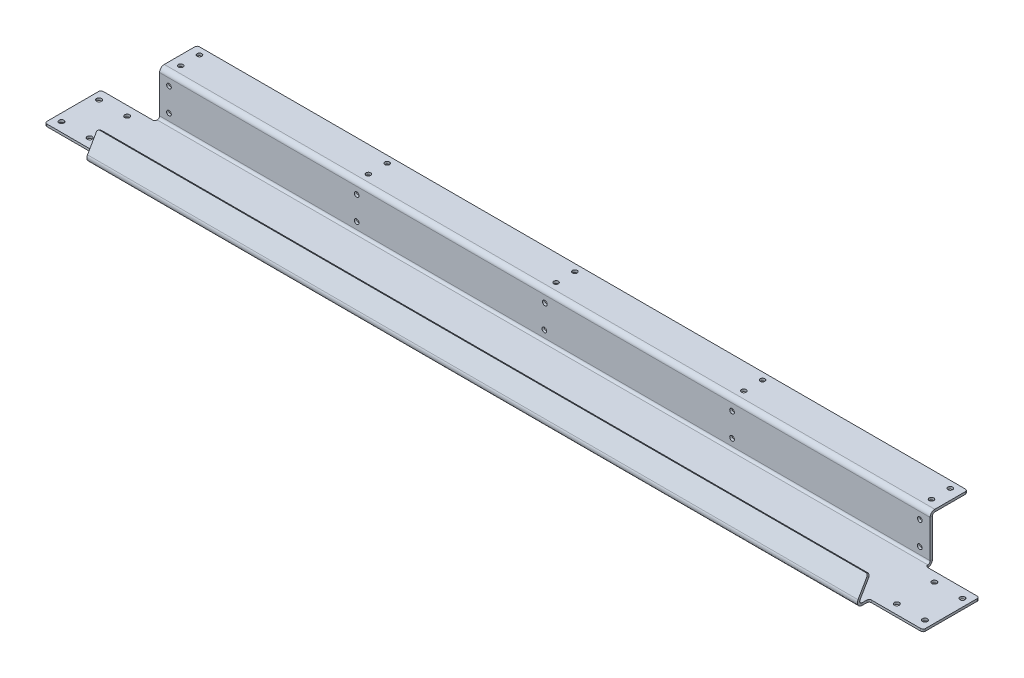
from build123d import *

# Parameters (mm, degrees)
BASE_FLANGE1_DEPTH               = 3.175
EDGE_FLANGE1_START               = -521.335
EDGE_FLANGE1_DEPTH               = 1042.67
EDGE_FLANGE1_START_2             = -521.760369343
EDGE_FLANGE1_2_DEPTH             = 0.425369343
EDGE_FLANGE1_START_3             = 521.335
EDGE_FLANGE1_3_DEPTH             = 0.425369343
EDGE_FLANGE1_4_DEPTH             = 1042.67
EDGE_FLANGE2_DEPTH               = 1042.67
EDGE_FLANGE3_STRIP_W             = 19.05
EDGE_FLANGE3_STRIP_H             = 3.175
EDGE_FLANGE3_STRIP_CUT_DEPTH     = 1042.67
EDGE_FLANGE3_DEPTH               = 1042.67
FILLET1_R                        = 3.175
F_17_64_0_26563_DIAMETER_HOLE1_D = 6.747002
F_1_4_0_25_DIAMETER_HOLE1_D      = 6.35
F_1_4_0_25_DIAMETER_HOLE2_D      = 6.35
F_1_4_0_25_DIAMETER_HOLE2_DEPTH  = 3.175


# Read off the part's stored shape, not the designer's step: Edge-Flange1
# Sheet-metal steps are written as plain solids
with BuildPart() as part:
    # Sketch1 → Base-Flange1 (new body)
    with BuildSketch(Plane(origin=(0, 0, 0), x_dir=(1, 0, 0), z_dir=(0, 1, 0))):
        with BuildLine():
            Line((-521.335, 41.275), (-521.335, 47.625))
            Line((-521.335, 47.625), (521.335, 47.625))
            Line((521.335, 47.625), (521.335, 41.275))
            ThreePointArc((521.335, 41.275), (522.26493597, 39.02993597), (524.51, 38.1))
            Line((524.51, 38.1), (594.36, 38.1))
            Line((594.36, 38.1), (594.36, -38.1))
            Line((594.36, -38.1), (524.51, -38.1))
            ThreePointArc((524.51, -38.1), (522.26493597, -39.02993597), (521.335, -41.275))
            Line((521.335, -41.275), (521.335, -47.625))
            Line((521.335, -47.625), (-521.335, -47.625))
            Line((-521.335, -47.625), (-521.335, -41.275))
            ThreePointArc((-521.335, -41.275), (-522.26493597, -39.02993597), (-524.51, -38.1))
            Line((-524.51, -38.1), (-594.36, -38.1))
            Line((-594.36, -38.1), (-594.36, 38.1))
            Line((-594.36, 38.1), (-524.51, 38.1))
            ThreePointArc((-524.51, 38.1), (-522.26493597, 39.02993597), (-521.335, 41.275))
        make_face()
    extrude(amount=-BASE_FLANGE1_DEPTH)

    # Edge-Flange1 outline → Edge-Flange1 (cut)
    with BuildSketch(Plane.YZ.offset(EDGE_FLANGE1_START)):
        with BuildLine():
            ThreePointArc((0, -46.774261315), (-2.324261314, -44.450000001), (-3.175, -41.275))
            Line((-3.175, -41.275), (-3.175, -47.625))
            Line((-3.175, -47.625), (0, -47.625))
            Line((0, -47.625), (0, -46.774261315))
        make_face()
    extrude(amount=EDGE_FLANGE1_DEPTH, mode=Mode.SUBTRACT)

    # Edge-Flange1 2 outline → Edge-Flange1 2 (cut)
    with BuildSketch(Plane.YZ.offset(EDGE_FLANGE1_START_2)):
        with BuildLine():
            Line((0, -39.6875), (-3.175, -39.6875))
            Line((-3.175, -39.6875), (-3.175, -41.275))
            ThreePointArc((-3.175, -41.275), (-2.324261314, -44.450000001), (0, -46.774261315))
            Line((0, -46.774261315), (0, -39.6875))
        make_face()
    extrude(amount=EDGE_FLANGE1_2_DEPTH, mode=Mode.SUBTRACT)

    # Edge-Flange1 3 outline → Edge-Flange1 3 (cut)
    with BuildSketch(Plane.YZ.offset(EDGE_FLANGE1_START_3)):
        with BuildLine():
            Line((0, -39.6875), (-3.175, -39.6875))
            Line((-3.175, -39.6875), (-3.175, -41.275))
            ThreePointArc((-3.175, -41.275), (-2.324261314, -44.450000001), (0, -46.774261315))
            Line((0, -46.774261315), (0, -39.6875))
        make_face()
    extrude(amount=EDGE_FLANGE1_3_DEPTH, mode=Mode.SUBTRACT)

    # Edge-Flange1 4 outline → Edge-Flange1 4 (add)
    with BuildSketch(Plane.YZ.offset(EDGE_FLANGE1_START)):
        with BuildLine():
            ThreePointArc((3.175, -44.45), (0.92993597, -43.52006403), (0, -41.275))
            Line((0, -41.275), (0, -46.774261315))
            ThreePointArc((0, -46.774261315), (1.531499064, -47.408628997), (3.175, -47.625))
            Line((3.175, -47.625), (60.325, -47.625))
            Line((60.325, -47.625), (60.325, -44.45))
            Line((60.325, -44.45), (3.175, -44.45))
        make_face()
    extrude(amount=EDGE_FLANGE1_4_DEPTH)

    # Edge-Flange2 section (across the edge) → Edge-Flange2 (add)
    with BuildSketch(Plane(origin=(-521.335, 0, 53.124261314), x_dir=(0, -0.499999999999998, -0.8660254037844398), z_dir=(1, 0, 0))):
        with BuildLine():
            Line((-3.175, 5.499261314), (-3.175, 32.600738686))
            Line((-3.175, 32.600738686), (0, 32.600738686))
            Line((0, 32.600738686), (0, 5.499261314))
            ThreePointArc((0, 5.499261314), (1.5875, 2.749630657), (4.7625, 2.749630657))
            Line((4.7625, 2.749630657), (6.35, 0))
            ThreePointArc((6.35, 0), (0, 0), (-3.175, 5.499261314))
        make_face()
    extrude(amount=EDGE_FLANGE2_DEPTH)

    # Edge-Flange3 strip (across the edge) → Edge-Flange3 strip cut (cut)
    with BuildSketch(Plane(origin=(-521.335, 60.325, -47.625), x_dir=(0, -1, 0), z_dir=(1, 0, 0))):
        with Locations((-3.175, -1.5875)):
            Rectangle(EDGE_FLANGE3_STRIP_W, EDGE_FLANGE3_STRIP_H)
    extrude(amount=EDGE_FLANGE3_STRIP_CUT_DEPTH, mode=Mode.SUBTRACT)

    # Edge-Flange3 section (across the edge) → Edge-Flange3 (add)
    with BuildSketch(Plane(origin=(-521.335, 60.325, -47.625), x_dir=(0, -1, 0), z_dir=(1, 0, 0))):
        with BuildLine():
            Line((0, 3.175), (0, 47.625))
            Line((0, 47.625), (3.175, 47.625))
            Line((3.175, 47.625), (3.175, 3.175))
            ThreePointArc((3.175, 3.175), (4.10493597, 0.92993597), (6.35, 0))
            Line((6.35, 0), (6.35, -3.175))
            ThreePointArc((6.35, -3.175), (1.859871939, -1.315128061), (0, 3.175))
        make_face()
    extrude(amount=EDGE_FLANGE3_DEPTH)

    # Fillet1
    fillet1_edges = [part.edges().sort_by_distance(p)[0] for p in [
        (-521.335, 29.026817884, 38.1987073),
        (521.335, 29.026817884, 38.1987073),
        (-521.335, 58.7375, -95.25),
        (521.335, 58.7375, -95.25),
        (594.36, -1.5875, -38.1),
        (594.36, -1.5875, 38.1),
        (-594.36, -1.5875, 38.1),
        (-594.36, -1.5875, -38.1),
    ]]
    fillet(fillet1_edges, radius=FILLET1_R)

    # 17/64 (0.26563) Diameter Hole1 (through all)
    with Locations(Plane(origin=(0, -3.175, 0), x_dir=(-1, 0, 0), z_dir=(0, -1, 0))):
        with Locations((-546.1, 25.4), (-584.2, 25.4), (-584.2, -25.4), (-546.1, -25.4), (546.1, 25.4), (584.2, 25.4), (584.2, -25.4), (546.1, -25.4)):
            Hole(F_17_64_0_26563_DIAMETER_HOLE1_D / 2)

    # 1/4 (0.25) Diameter Hole1 (through all)
    with Locations(Plane(origin=(0, 57.15, 0), x_dir=(-1, 0, 0), z_dir=(0, -1, 0))):
        with Locations((-507.365, 85.725), (-507.365, 60.325), (-253.365, 85.725), (-253.365, 60.325), (0.635, 85.725), (0.635, 60.325), (254.635, 85.725), (254.635, 60.325), (508.635, 85.725), (508.635, 60.325)):
            Hole(F_1_4_0_25_DIAMETER_HOLE1_D / 2)

    # 1/4 (0.25) Diameter Hole2
    with Locations(Plane(origin=(0, 0, -47.625), x_dir=(-1, 0, 0), z_dir=(0, 0, -1))):
        with Locations((508.635, 44.45), (508.635, 12.7), (254.635, 44.45), (254.635, 12.7), (0, 44.45), (0.635, 12.7), (-253.365, 44.45), (-253.365, 12.7), (-507.365, 44.45), (-507.365, 12.7)):
            Hole(F_1_4_0_25_DIAMETER_HOLE2_D / 2, depth=F_1_4_0_25_DIAMETER_HOLE2_DEPTH)


solid = part.part
